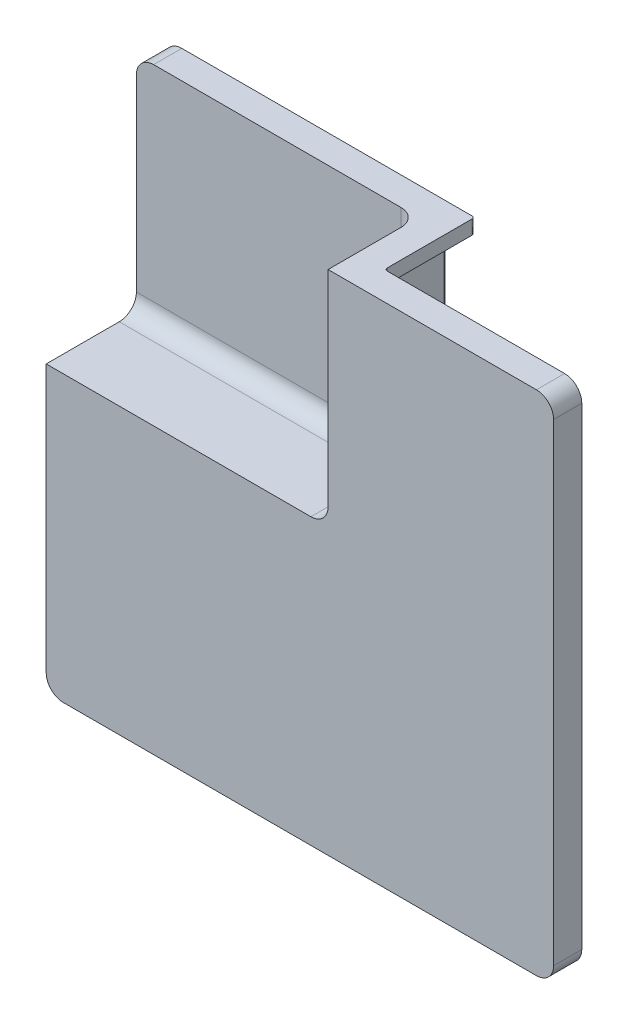
from build123d import *
from build123d.topology import SkipClean

# Parameters (mm, degrees)
BOSS_EXTRUDE1_DEPTH = 5
BOSS_EXTRUDE2_START = -10
BOSS_EXTRUDE2_DEPTH = 10
SKETCH4_W           = 100
SKETCH4_H           = 79
CUT_EXTRUDE1_DEPTH  = 30
BOSS_EXTRUDE3_DEPTH = 37
SKETCH8_W           = 5
SKETCH8_H           = 79
BOSS_EXTRUDE6_DEPTH = 100
FILLET3_R           = 6.1
FILLET4_R           = 6.1
BOSS_EXTRUDE7_DEPTH = 5
SKETCH10_W          = 5
SKETCH10_H          = 32
BOSS_EXTRUDE8_DEPTH = 5
SKETCH11_W          = 32
SKETCH11_H          = 5
BOSS_EXTRUDE9_DEPTH = 5
FILLET6_R           = 1


with BuildPart() as part:
    # Sketch1 → Boss-Extrude1 (new body)
    with BuildSketch(Plane.XY):
        with BuildLine():
            Line((-57.206320908, 108.379254457), (110.593679092, 108.379254457))
            ThreePointArc((110.593679092, 108.379254457), (114.907030458, 106.592605822), (116.693679092, 102.279254457))
            Line((116.693679092, 102.279254457), (116.693679092, -65.520745543))
            ThreePointArc((116.693679092, -65.520745543), (114.907030458, -69.834096908), (110.593679092, -71.620745543))
            Line((110.593679092, -71.620745543), (-57.206320908, -71.620745543))
            ThreePointArc((-57.206320908, -71.620745543), (-61.519672273, -69.834096908), (-63.306320908, -65.520745543))
            Line((-63.306320908, -65.520745543), (-63.306320908, 102.279254457))
            ThreePointArc((-63.306320908, 102.279254457), (-61.519672273, 106.592605822), (-57.206320908, 108.379254457))
        make_face()
    extrude(amount=BOSS_EXTRUDE1_DEPTH)

    # Sketch3 → Boss-Extrude2 (add)
    with SkipClean():  # the faces are left unmerged after this step: merging them gives an invalid solid
        with BuildSketch(Plane.XY.offset(5).offset(BOSS_EXTRUDE2_START)):
            with BuildLine():
                ThreePointArc((-57.206320908, 108.379254457), (-61.519672273, 106.592605822), (-63.306320908, 102.279254457))
                Line((-63.306320908, 102.279254457), (-63.306320908, -65.520745543))
                ThreePointArc((-63.306320908, -65.520745543), (-61.519672273, -69.834096908), (-57.206320908, -71.620745543))
                Line((-57.206320908, -71.620745543), (110.593679092, -71.620745543))
                ThreePointArc((110.593679092, -71.620745543), (114.907030458, -69.834096908), (116.693679092, -65.520745543))
                Line((116.693679092, -65.520745543), (116.693679092, 102.279254457))
                ThreePointArc((116.693679092, 102.279254457), (114.907030458, 106.592605822), (110.593679092, 108.379254457))
                Line((110.593679092, 108.379254457), (-57.206320908, 108.379254457))
            make_face()
            with BuildLine():
                Line((105.593338585, -66.620625471), (-52.206661415, -66.620625471))
                ThreePointArc((-52.206661415, -66.620625471), (-56.520012781, -64.833976836), (-58.306661415, -60.520625471))
                Line((-58.306661415, -60.520625471), (-58.306661415, 97.279374529))
                ThreePointArc((-58.306661415, 97.279374529), (-56.520012781, 101.592725894), (-52.206661415, 103.379374529))
                Line((-52.206661415, 103.379374529), (105.593338585, 103.379374529))
                ThreePointArc((105.593338585, 103.379374529), (109.90668995, 101.592725894), (111.693338585, 97.279374529))
                Line((111.693338585, 97.279374529), (111.693338585, -60.520625471))
                ThreePointArc((111.693338585, -60.520625471), (109.90668995, -64.833976836), (105.593338585, -66.620625471))
            make_face(mode=Mode.SUBTRACT)
        extrude(amount=BOSS_EXTRUDE2_DEPTH)
    add(part.part.scale(1), mode=Mode.REPLACE)  # the faces are merged on a copy

    # Sketch4 → Cut-Extrude1 (cut, symmetric)
    with BuildSketch(Plane.XY.offset(5)):
        with Locations((-13.306320908, 68.879254457)):
            Rectangle(SKETCH4_W, SKETCH4_H)
    extrude(amount=CUT_EXTRUDE1_DEPTH, both=True, mode=Mode.SUBTRACT)

    # Sketch5 → Boss-Extrude3 (add)
    with BuildSketch(Plane.XY.offset(5)):
        with BuildLine():
            Line((36.693679092, 108.379254457), (41.693679092, 108.379254457))
            Line((41.693679092, 108.379254457), (41.693679092, 30.479254457))
            ThreePointArc((41.693679092, 30.479254457), (39.907030458, 26.165903092), (35.593679092, 24.379254457))
            Line((35.593679092, 24.379254457), (-63.306320908, 24.379254457))
            Line((-63.306320908, 24.379254457), (-63.306320908, 29.379254457))
            Line((-63.306320908, 29.379254457), (30.593679092, 29.379254457))
            ThreePointArc((30.593679092, 29.379254457), (34.907030458, 31.165903092), (36.693679092, 35.479254457))
            Line((36.693679092, 35.479254457), (36.693679092, 108.379254457))
        make_face()
    extrude(amount=-BOSS_EXTRUDE3_DEPTH)

    # Sketch8 → Boss-Extrude6 (add)
    with BuildSketch(Plane.ZY.offset(-36.693679092)):
        with Locations((-29.5, 68.879254457)):
            Rectangle(SKETCH8_W, SKETCH8_H)
    extrude(amount=BOSS_EXTRUDE6_DEPTH)

    # Fillet3
    fillet3_edges = [part.edges().sort_by_distance(p)[0] for p in [
        (-63.306320908, 108.379254457, -29.5),
    ]]
    fillet(fillet3_edges, radius=FILLET3_R)

    # Fillet4
    fillet4_edges = [part.edges().sort_by_distance(p)[0] for p in [
        (34.907030458, 31.165903092, -27),
        (36.693679092, 71.929254457, -27),
        (-16.356320908, 29.379254457, -27),
    ]]
    fillet(fillet4_edges, radius=FILLET4_R)

    # Sketch9 → Boss-Extrude7 (add)
    with BuildSketch(Plane(origin=(0, 0, -32), x_dir=(-1, 0, 0), z_dir=(0, 0, -1))):
        with BuildLine():
            Line((-41.693679092, 103.379254457), (52.206342763, 103.379254457))
            ThreePointArc((52.206342763, 103.379254457), (56.519684701, 101.592615249), (58.306342763, 97.279281121))
            Line((58.306342763, 97.279281121), (58.306661415, 24.379254457))
            Line((58.306661415, 24.379254457), (63.306661415, 24.379254457))
            Line((63.306661415, 24.379254457), (63.306320908, 102.279254457))
            ThreePointArc((63.306320908, 102.279254457), (61.519672273, 106.592605822), (57.206320908, 108.379254457))
            Line((57.206320908, 108.379254457), (-41.693679092, 108.379254457))
            Line((-41.693679092, 108.379254457), (-41.693679092, 103.379254457))
        make_face()
    extrude(amount=BOSS_EXTRUDE7_DEPTH)

    # Sketch10 → Boss-Extrude8 (add)
    with BuildSketch(Plane.XZ.offset(-24.379254457)):
        with Locations((-60.806661415, -21)):
            Rectangle(SKETCH10_W, SKETCH10_H)
    extrude(amount=BOSS_EXTRUDE8_DEPTH)

    # Sketch11 → Boss-Extrude9 (add)
    with BuildSketch(Plane(origin=(41.693679092, 0, 0), x_dir=(0, 0, -1), z_dir=(1, 0, 0))):
        with Locations((21, 105.879254457)):
            Rectangle(SKETCH11_W, SKETCH11_H)
    extrude(amount=BOSS_EXTRUDE9_DEPTH)

    # Fillet6
    fillet6_edges = [part.edges().sort_by_distance(p)[0] for p in [
        (73.643508838, 103.379374529, 0),
        (-11.356491162, 24.379254457, 0),
        (39.907030458, 26.165903092, 0),
        (41.693679092, 66.929314493, 0),
        (41.693679092, 66.929254457, -32),
        (39.907030458, 26.165903092, -32),
        (-11.356491162, 24.379254457, -32),
        (-60.806661415, 19.379254457, -37),
        (-60.806491162, 19.379254457, -5),
        (-58.306661415, -18.070685507, 0),
        (46.693679092, 105.879254457, -37),
        (46.693679092, 105.879314493, -5),
        (109.90668995, 101.592725894, 0),
        (111.693338585, 18.379374529, 0),
        (109.90668995, -64.833976836, 0),
        (26.693338585, -66.620625471, 0),
        (-56.520012781, -64.833976836, 0),
    ]]
    fillet(fillet6_edges, radius=FILLET6_R)


solid = part.part
